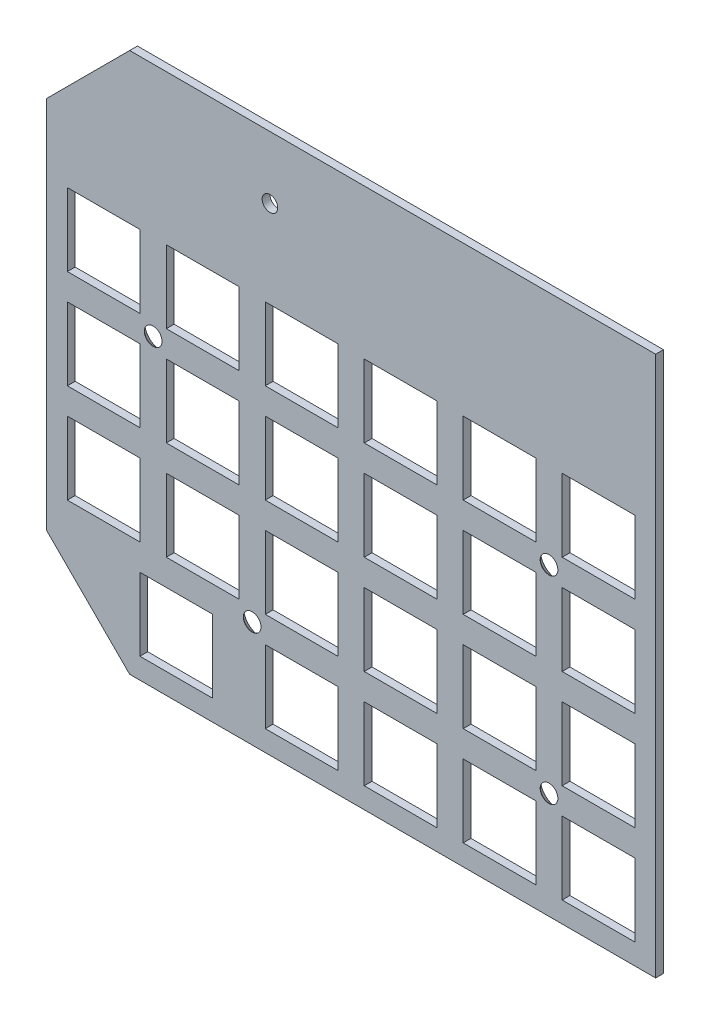
from build123d import *

# Parameters (mm, degrees)
BOSS_EXTRU_1_DEPTH                          = 1.5
ESQUISSE3_R                                 = 1.5
ESQUISSE3_W                                 = 14
ESQUISSE3_H                                 = 14
ENL_V_MAT_EXTRU_2_DEPTH                     = 10
FRAISAGE_POUR_VIS_T_TE_FRAIS_E_M31_AT_COUNT = 2
FRAISAGE_POUR_VIS_T_TE_FRAIS_E_M31_AT_PITCH = 38.1
FRAISAGE_POUR_VIS_T_TE_FRAIS_E_M31_2_COUNT  = 2
FRAISAGE_POUR_VIS_T_TE_FRAIS_E_M31_2_PITCH  = 76.2
FRAISAGE_POUR_VIS_T_TE_FRAIS_E_M31_3_COUNT  = 2
FRAISAGE_POUR_VIS_T_TE_FRAIS_E_M31_3_PITCH  = 68.685751798


with BuildPart() as part:
    # Esquisse1 → Boss.-Extru.1 (new body)
    with BuildSketch(Plane.XY):
        Polygon((0, -85), (16, -101), (117.25, -101), (117.25, 3), (16, 3), (0, -13), align=None)
    extrude(amount=BOSS_EXTRU_1_DEPTH)

    # Esquisse3 → Enlèv. mat.-Extru.2 (cut)
    with BuildSketch(Plane(origin=(0, 0, 0), x_dir=(-1, 0, 0), z_dir=(0, 0, -1))):
        with Locations((-43, -9)):
            Circle(ESQUISSE3_R)
        with Locations((-87.2, -32.85)):
            Rectangle(ESQUISSE3_W, ESQUISSE3_H)
        with Locations((-106.25, -32.85)):
            Rectangle(ESQUISSE3_W, ESQUISSE3_H)
        with Locations((-68.15, -32.85)):
            Rectangle(ESQUISSE3_W, ESQUISSE3_H)
        with Locations((-49.1, -32.85)):
            Rectangle(ESQUISSE3_W, ESQUISSE3_H)
        with Locations((-30.05, -32.85)):
            Rectangle(ESQUISSE3_W, ESQUISSE3_H)
        with Locations((-11, -32.85)):
            Rectangle(ESQUISSE3_W, ESQUISSE3_H)
        with Locations((-87.2, -51.9)):
            Rectangle(ESQUISSE3_W, ESQUISSE3_H)
        with Locations((-68.15, -51.9)):
            Rectangle(ESQUISSE3_W, ESQUISSE3_H)
        with Locations((-49.1, -51.9)):
            Rectangle(ESQUISSE3_W, ESQUISSE3_H)
        with Locations((-30.05, -51.9)):
            Rectangle(ESQUISSE3_W, ESQUISSE3_H)
        with Locations((-11, -51.9)):
            Rectangle(ESQUISSE3_W, ESQUISSE3_H)
        with Locations((-87.2, -70.95)):
            Rectangle(ESQUISSE3_W, ESQUISSE3_H)
        with Locations((-68.15, -70.95)):
            Rectangle(ESQUISSE3_W, ESQUISSE3_H)
        with Locations((-49.1, -70.95)):
            Rectangle(ESQUISSE3_W, ESQUISSE3_H)
        with Locations((-30.05, -70.95)):
            Rectangle(ESQUISSE3_W, ESQUISSE3_H)
        with Locations((-11, -70.95)):
            Rectangle(ESQUISSE3_W, ESQUISSE3_H)
        with Locations((-87.2, -90)):
            Rectangle(ESQUISSE3_W, ESQUISSE3_H)
        with Locations((-68.15, -90)):
            Rectangle(ESQUISSE3_W, ESQUISSE3_H)
        with Locations((-49.1, -90)):
            Rectangle(ESQUISSE3_W, ESQUISSE3_H)
        with Locations((-106.25, -51.9)):
            Rectangle(ESQUISSE3_W, ESQUISSE3_H)
        with Locations((-106.25, -70.95)):
            Rectangle(ESQUISSE3_W, ESQUISSE3_H)
        with Locations((-106.25, -90)):
            Rectangle(ESQUISSE3_W, ESQUISSE3_H)
        with Locations((-24.97, -90)):
            Rectangle(ESQUISSE3_W, ESQUISSE3_H)
    extrude(amount=-ENL_V_MAT_EXTRU_2_DEPTH, mode=Mode.SUBTRACT)

    # Esquisse6 → Fraisage pour vis à tête fraisée M31 (revolve, cut)
    with BuildSketch(Plane(origin=(96.725, -42.375, 0), x_dir=(0, 1, 0), z_dir=(1, 0, 0))):
        Polygon((0, 0), (0, 1.5), (1.7, 1.5), (1.7, 1.45), (3.15, 0), align=None)
    fraisage_pour_vis_t_te_frais_e_m31 = revolve(axis=Axis((96.725, -42.375, -6.35), (0, 0, 1)), mode=Mode.SUBTRACT)

    # Fraisage pour vis à tête fraisée M31 at: Fraisage pour vis à tête fraisée M31 ×2
    with Locations(*[(0, -i * FRAISAGE_POUR_VIS_T_TE_FRAIS_E_M31_AT_PITCH, 0) for i in range(1, FRAISAGE_POUR_VIS_T_TE_FRAIS_E_M31_AT_COUNT)]):
        add(fraisage_pour_vis_t_te_frais_e_m31, mode=Mode.SUBTRACT)

    # Fraisage pour vis _ t_te frais_e M31 2: Fraisage pour vis à tête fraisée M31 ×2
    with Locations(*[(-i * FRAISAGE_POUR_VIS_T_TE_FRAIS_E_M31_2_PITCH, 0, 0) for i in range(1, FRAISAGE_POUR_VIS_T_TE_FRAIS_E_M31_2_COUNT)]):
        add(fraisage_pour_vis_t_te_frais_e_m31, mode=Mode.SUBTRACT)

    # Fraisage pour vis _ t_te frais_e M31 3: Fraisage pour vis à tête fraisée M31 ×2
    with Locations(*[Vector(-0.8320502943378435, -0.5547001962252295, 0) * (i * FRAISAGE_POUR_VIS_T_TE_FRAIS_E_M31_3_PITCH) for i in range(1, FRAISAGE_POUR_VIS_T_TE_FRAIS_E_M31_3_COUNT)]):
        add(fraisage_pour_vis_t_te_frais_e_m31, mode=Mode.SUBTRACT)


solid = part.part
